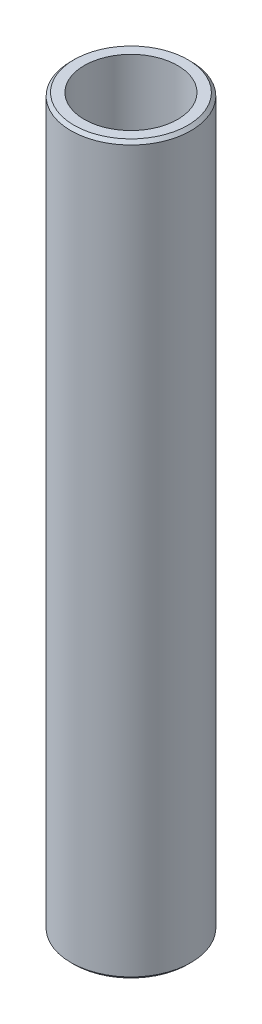
from build123d import *

# Parameters (mm, degrees)
SKETCH1_R           = 47.5
BOSS_EXTRUDE1_DEPTH = 575.080637055
SKETCH2_R           = 36.973795119
CUT_EXTRUDE1_DEPTH  = 579.990707279
CHAMFER1_SIZE       = 2.470031954


with BuildPart() as part:
    # Sketch1 → Boss-Extrude1 (new body)
    with BuildSketch(Plane(origin=(0, 0, 0), x_dir=(1, 0, 0), z_dir=(0, 1, 0))):
        Circle(SKETCH1_R)
    extrude(amount=BOSS_EXTRUDE1_DEPTH)

    # Sketch2 → Cut-Extrude1 (cut, through all)
    with BuildSketch(Plane(origin=(0, 0, 0), x_dir=(1, 0, 0), z_dir=(0, 1, 0))):
        Circle(SKETCH2_R)
    extrude(amount=CUT_EXTRUDE1_DEPTH, mode=Mode.SUBTRACT)

    # Chamfer1
    chamfer1_edges = [part.edges().sort_by_distance(p)[0] for p in [
        (-47.5, 575.080637055, 0),
        (-47.5, 0, 0),
    ]]
    chamfer(chamfer1_edges, length=CHAMFER1_SIZE)


solid = part.part
